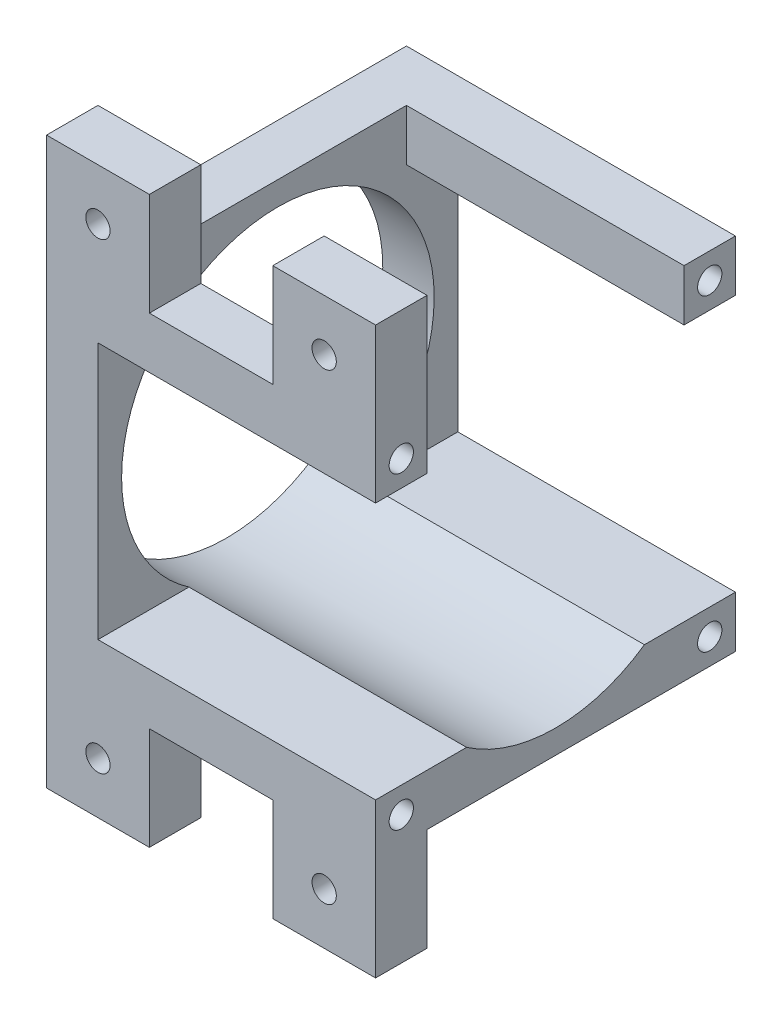
from build123d import *

# Parameters (mm, degrees)
SKETCH1_W           = 40.64
SKETCH1_H           = 44.45
BOSS_EXTRUDE1_DEPTH = 44.45
SKETCH4_R           = 19.304
CUT_EXTRUDE3_DEPTH  = 75.854623104
SKETCH5_W           = 34.29
SKETCH5_H           = 38.1
CUT_EXTRUDE4_DEPTH  = 75.854623104
SKETCH6_W           = 6.35
SKETCH6_H           = 6.35
BOSS_EXTRUDE2_DEPTH = 34.29
SKETCH7_R           = 1.5
CUT_EXTRUDE5_DEPTH  = 6.35
SKETCH8_W           = 12.7
SKETCH8_H           = 6.35
BOSS_EXTRUDE3_DEPTH = 12.7
SKETCH9_R           = 1.5
CUT_EXTRUDE6_DEPTH  = 12.7
LPATTERN1_COUNT     = 2
LPATTERN1_PITCH     = 57.15


with BuildPart() as part:
    # Sketch1 → Boss-Extrude1 (new body)
    with BuildSketch(Plane(origin=(0, 0, 0), x_dir=(1, 0, 0), z_dir=(0, 1, 0))):
        with Locations((20.32, 22.225)):
            Rectangle(SKETCH1_W, SKETCH1_H)
    extrude(amount=BOSS_EXTRUDE1_DEPTH)

    # Sketch4 → Cut-Extrude3 (cut, through all)
    with BuildSketch(Plane.ZY):
        with Locations((-22.225, 22.225)):
            Circle(SKETCH4_R)
    extrude(amount=-CUT_EXTRUDE3_DEPTH, mode=Mode.SUBTRACT)

    # Sketch5 → Cut-Extrude4 (cut, through all)
    with BuildSketch(Plane(origin=(0, 0, -44.45), x_dir=(-1, 0, 0), z_dir=(0, 0, -1))):
        with Locations((-23.495, 25.4)):
            Rectangle(SKETCH5_W, SKETCH5_H)
    extrude(amount=-CUT_EXTRUDE4_DEPTH, mode=Mode.SUBTRACT)

    # Sketch6 → Boss-Extrude2 (add)
    with BuildSketch(Plane(origin=(6.35, 0, 0), x_dir=(0, 0, -1), z_dir=(1, 0, 0))):
        with Locations((3.175, 41.275)):
            Rectangle(SKETCH6_W, SKETCH6_H)
        with Locations((41.275, 41.275)):
            Rectangle(SKETCH6_W, SKETCH6_H)
    extrude(amount=BOSS_EXTRUDE2_DEPTH)

    # Sketch7 → Cut-Extrude5 (cut)
    with BuildSketch(Plane(origin=(40.64, 0, 0), x_dir=(0, 0, -1), z_dir=(1, 0, 0))):
        with Locations((3.175, 41.275)):
            Circle(SKETCH7_R)
        with Locations((41.275, 41.275)):
            Circle(SKETCH7_R)
        with Locations((41.275, 3.175)):
            Circle(SKETCH7_R)
        with Locations((3.175, 3.175)):
            Circle(SKETCH7_R)
    extrude(amount=-CUT_EXTRUDE5_DEPTH, mode=Mode.SUBTRACT)

    # Sketch8 → Boss-Extrude3 (add)
    with BuildSketch(Plane(origin=(0, 44.45, 0), x_dir=(1, 0, 0), z_dir=(0, 1, 0))):
        with Locations((6.35, 3.175)):
            Rectangle(SKETCH8_W, SKETCH8_H)
        with Locations((34.29, 3.175)):
            Rectangle(SKETCH8_W, SKETCH8_H)
    boss_extrude3 = extrude(amount=BOSS_EXTRUDE3_DEPTH)

    # Sketch9 → Cut-Extrude6 (cut)
    with BuildSketch(Plane(origin=(0, 0, -6.35), x_dir=(-1, 0, 0), z_dir=(0, 0, -1))):
        with Locations((-6.35, 50.8)):
            Circle(SKETCH9_R)
        with Locations((-34.29, 50.8)):
            Circle(SKETCH9_R)
    cut_extrude6 = extrude(amount=-CUT_EXTRUDE6_DEPTH, mode=Mode.SUBTRACT)

    # LPattern1: Boss-Extrude3, Cut-Extrude6 ×2
    with Locations(*[(0, -i * LPATTERN1_PITCH, 0) for i in range(1, LPATTERN1_COUNT)]):
        add(boss_extrude3)
        add(cut_extrude6, mode=Mode.SUBTRACT)


solid = part.part
